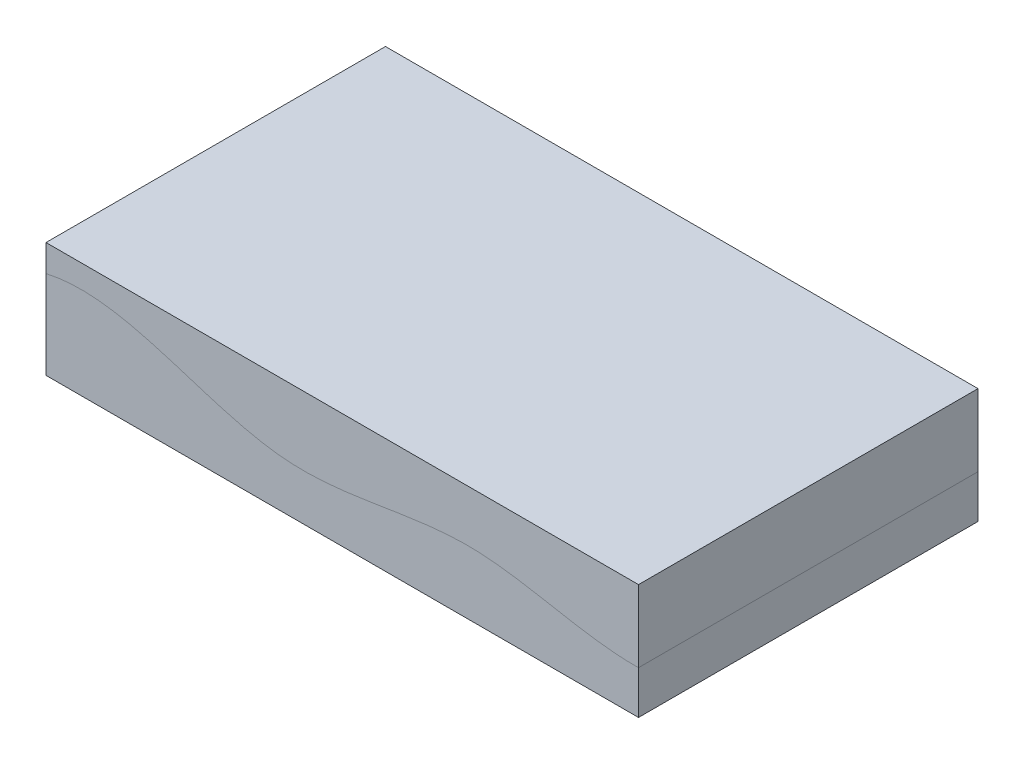
from build123d import *

# Parameters (mm, degrees)
SKETCH1_W           = 257.423641252
SKETCH1_H           = 147.49006692
BOSS_EXTRUDE1_DEPTH = 50
INTERSECT1_START    = -73.74503346
INTERSECT1_DEPTH    = 147.49006692
INTERSECT1_2_DEPTH  = 147.49006692


# Read off the part's stored shape, not the designer's step: Intersect1
with BuildPart() as part:
    # Sketch1 → Boss-Extrude1 (new body)
    with BuildSketch(Plane(origin=(0, 0, 0), x_dir=(1, 0, 0), z_dir=(0, 1, 0))):
        Rectangle(SKETCH1_W, SKETCH1_H)
    extrude(amount=BOSS_EXTRUDE1_DEPTH)

    # Intersect1 outline → Intersect1 (cut)
    with BuildSketch(Plane.XY.offset(INTERSECT1_START)):
        with BuildLine():
            add(Edge.make_bspline(
                [(-128.711820626, 38.300263387), (-93.95042027, 46.3677643), (-33.928882118, 5.417498568), (54.115890209, 36.883510422), (104.708521915, 18.332859687), (128.711820626, 18.743046177)],
                knots=[0.102331594, 0.102331594, 0.102331594, 0.102331594, 0.428404103, 0.673907152, 0.894339808, 0.894339808, 0.894339808, 0.894339808], degree=3))
            Line((-128.711820626, 38.300263387), (-128.711820626, 0))
            Line((-128.711820626, 0), (128.711820626, 0))
            Line((128.711820626, 0), (128.711820626, 18.743046177))
        make_face()
    extrude(amount=INTERSECT1_DEPTH, mode=Mode.SUBTRACT)


with BuildPart() as body_2:
    # Intersect1 2 outline → Intersect1 2 (new body)
    with BuildSketch(Plane.XY.offset(INTERSECT1_START)):
        with BuildLine():
            add(Edge.make_bspline(
                [(-128.711820626, 38.300263387), (-93.95042027, 46.3677643), (-33.928882118, 5.417498568), (54.115890209, 36.883510422), (104.708521915, 18.332859687), (128.711820626, 18.743046177)],
                knots=[0.102331594, 0.102331594, 0.102331594, 0.102331594, 0.428404103, 0.673907152, 0.894339808, 0.894339808, 0.894339808, 0.894339808], degree=3))
            Line((-128.711820626, 38.300263387), (-128.711820626, 0))
            Line((-128.711820626, 0), (128.711820626, 0))
            Line((128.711820626, 0), (128.711820626, 18.743046177))
        make_face()
    extrude(amount=INTERSECT1_2_DEPTH)


solid = Compound([part.part, body_2.part])
